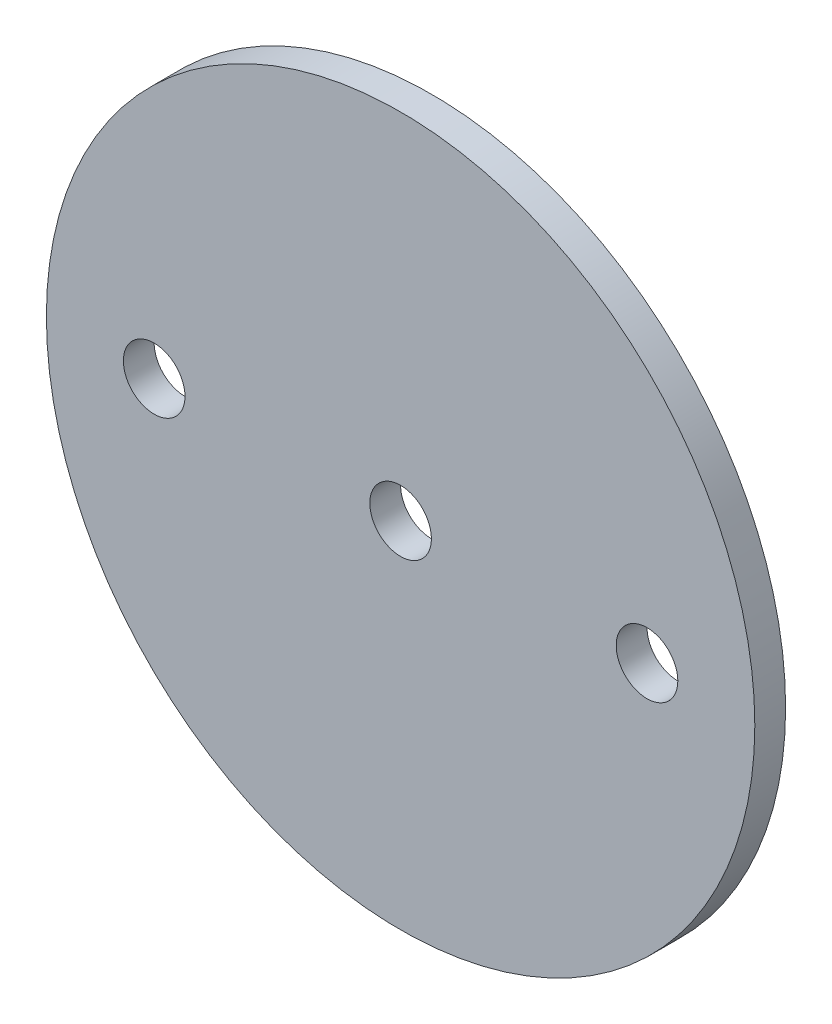
from build123d import *

# Parameters (mm, degrees)
SKETCH1_R                   = 36.5125
BOSS_EXTRUDE1_DEPTH         = 1.5875
F_1_4_0_25_DIAMETER_HOLE1_D = 6.35


with BuildPart() as part:
    # Sketch1 → Boss-Extrude1 (new, symmetric)
    with BuildSketch(Plane.XY):
        Circle(SKETCH1_R)
    extrude(amount=BOSS_EXTRUDE1_DEPTH, both=True)

    # 1/4 (0.25) Diameter Hole1 (through all)
    with Locations(Plane.XY.offset(1.5875)):
        with Locations((-25.4, 0), (0, 0), (25.4, 0)):
            Hole(F_1_4_0_25_DIAMETER_HOLE1_D / 2)


solid = part.part
